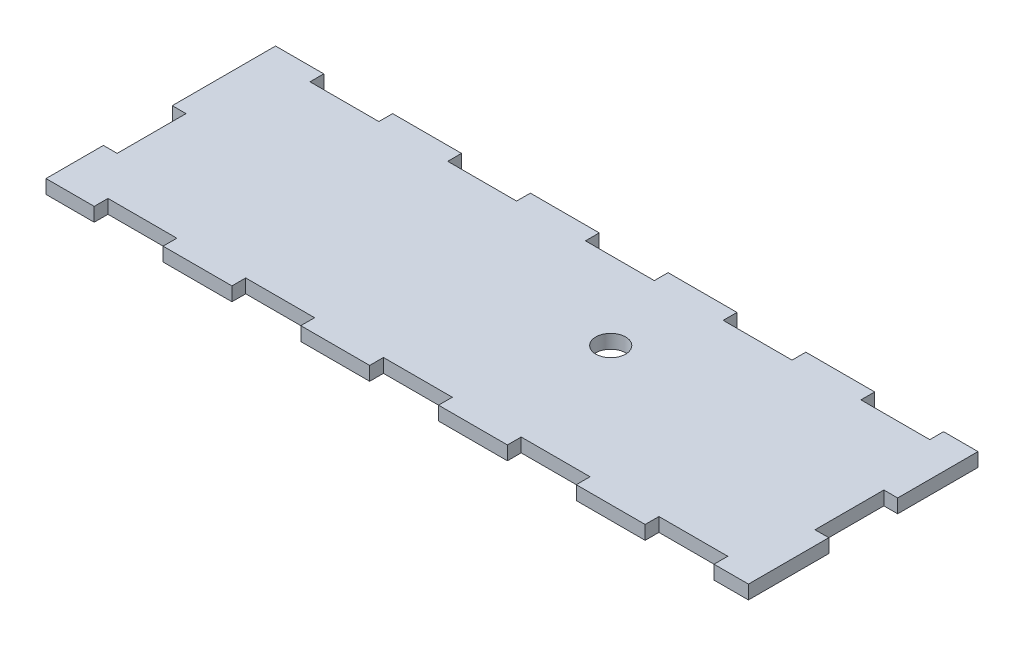
from build123d import *

# Parameters (mm, degrees)
CROQUIS1_R              = 3.25
SALIENTE_EXTRUIR1_DEPTH = 3


with BuildPart() as part:
    # Croquis1 → Saliente-Extruir1 (new body)
    with BuildSketch(Plane(origin=(0, 0, 0), x_dir=(1, 0, 0), z_dir=(0, 1, 0))):
        Polygon((0, 12.5), (0, 0), (10.5, 0), (10.5, 3), (25.5, 3), (25.5, 0), (40.5, 0), (40.5, 3), (55.5, 3), (55.5, 0), (70.5, 0), (70.5, 3), (85.5, 3), (85.5, 0), (100.5, 0), (100.5, 3), (115.5, 3), (115.5, 0), (130.5, 0), (130.5, 3), (145.5, 3), (145.5, 0), (153, 0), (153, 17.5), (150, 17.5), (150, 25), (150, 32.5), (153, 32.5), (153, 50), (145.5, 50), (145.5, 47), (130.5, 47), (130.5, 50), (115.5, 50), (115.5, 47), (100.5, 47), (100.5, 50), (93, 50), (85.5, 50), (85.5, 47), (70.5, 47), (70.5, 50), (67.60876348, 50), (55.5, 50), (55.5, 47), (40.5, 47), (40.5, 50), (25.5, 50), (25.5, 47), (10.5, 47), (10.5, 50), (3, 50), (0, 50), (0, 40), (0, 27.5), (3, 27.5), (3, 20), (3, 12.5), align=None)
        with Locations((93, 30)):
            Circle(CROQUIS1_R, mode=Mode.SUBTRACT)
    extrude(amount=SALIENTE_EXTRUIR1_DEPTH)


solid = part.part
